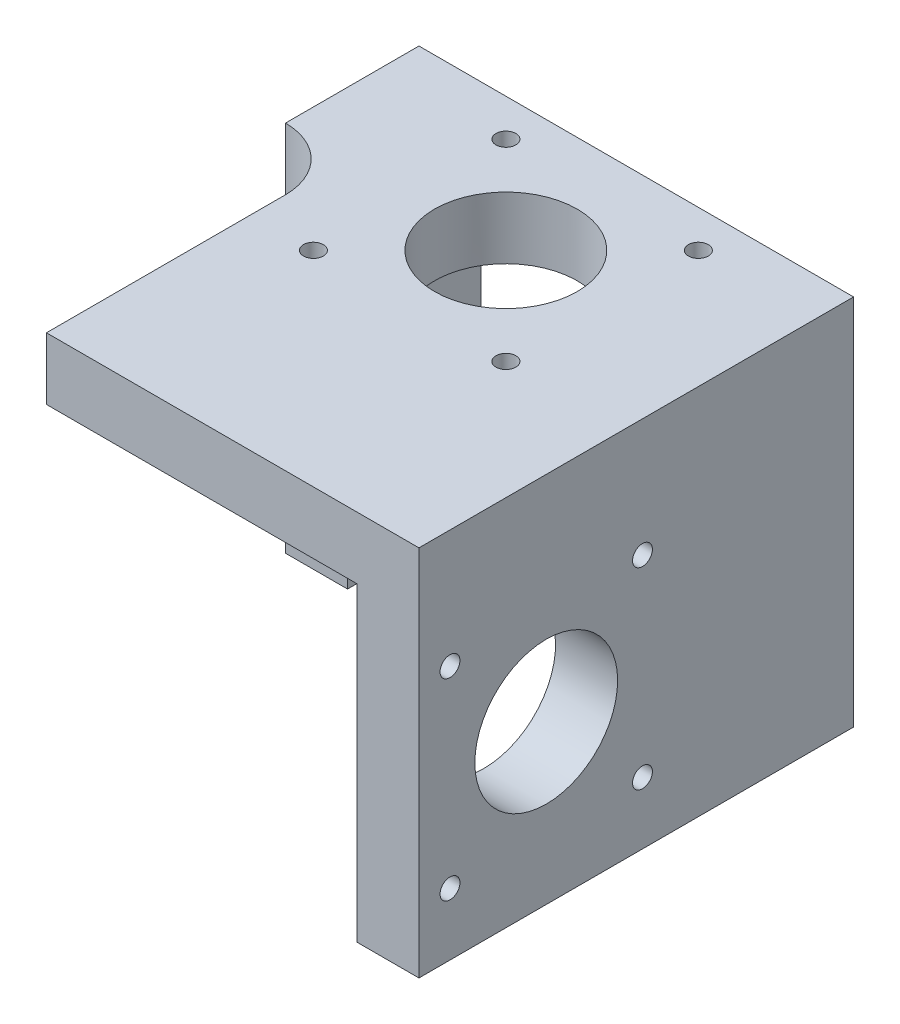
from build123d import *

# Parameters (mm, degrees)
EXTRUDE_1_DEPTH     = 70
SKETCH_2_R          = 1.5999999999999974
SKETCH_2_R_2        = 1.5999999999999979
SKETCH_2_R_3        = 1.6000000000000019
SKETCH_2_R_4        = 1.599999999999995
SKETCH_2_R_5        = 11.5
CUT_EXTRUDE_1_DEPTH = 60
SKETCH_4_R          = 1.6000000000000052
SKETCH_4_R_2        = 1.600000000000005
SKETCH_4_R_3        = 11.499999999999998
CUT_EXTRUDE_2_DEPTH = 60
EXTRUDE_2_DEPTH     = 21.5
SKETCH_7_R          = 4.549999999999999
CUT_EXTRUDE_3_DEPTH = 20.5
FILLET_1_R          = 10
FILLET_START        = 9.961129412
FILLET_2_DEPTH      = 10.1124
FILLET_START_2      = 0.073529412
FILLET_2_2_DEPTH    = 9.8876
FILLET_START_3      = -57.5
FILLET_2_3_DEPTH    = 10


with BuildPart() as part:
    # 草图1 → 凸台-拉伸1 (new body)
    with BuildSketch(Plane.XY):
        Polygon((2.500000000000014, 20.073529411764707), (-47.499999999999986, 20.073529411764703), (-47.499999999999986, 10.073529411764701), (2.500000000000014, 10.073529411764705), (2.5000000000000178, -39.9264705882353), (12.500000000000018, -39.92647058823529), (12.500000000000012, 10.073529411764705), (12.50000000000001, 20.073529411764707), align=None)
    extrude(amount=EXTRUDE_1_DEPTH)

    # 草图2 → 切除-拉伸1 (cut)
    with BuildSketch(Plane.XZ.offset(-10.073529411764705)):
        with Locations((-37.49999999999999, 37)):
            Circle(SKETCH_2_R)
        with Locations((-37.49999999999998, 6)):
            Circle(SKETCH_2_R_2)
        with Locations((-6.4999999999999885, 5.999999999999998)):
            Circle(SKETCH_2_R_3)
        with Locations((-6.499999999999992, 36.99999999999999)):
            Circle(SKETCH_2_R_4)
        with Locations((-21.999999999999996, 21.499999999999996)):
            Circle(SKETCH_2_R_5)
    extrude(amount=-CUT_EXTRUDE_1_DEPTH, mode=Mode.SUBTRACT)

    # 草图4 → 切除-拉伸2 (cut)
    with BuildSketch(Plane.ZY.offset(-2.500000000000012)):
        with Locations(Location((34, 1.0735294117647036, 0), (0, 0, 270))):
            Circle(SKETCH_4_R)
        with Locations(Location((34.000000000000014, -29.926470588235297, 0), (0, 0, 270))):
            Circle(SKETCH_4_R_2)
        with Locations(Location((65, -29.926470588235297, 0), (0, 0, 270))):
            Circle(SKETCH_4_R_2)
        with Locations(Location((65, 1.0735294117647038, 0), (0, 0, 270))):
            Circle(SKETCH_4_R)
        with Locations(Location((49.5, -14.426470588235297, 0), (0, 0, 270))):
            Circle(SKETCH_4_R_3)
    extrude(amount=-CUT_EXTRUDE_2_DEPTH, mode=Mode.SUBTRACT)

    # 草图6 → 凸台-拉伸2 (add)
    with BuildSketch(Plane(origin=(0, 0, 0), x_dir=(-1, 0, 0), z_dir=(0, 0, -1))):
        Polygon((47.499999999999986, 20.073529411764703), (57.499999999999986, 20.073529411764703), (57.49999999999999, -39.9264705882353), (47.49999999999999, -39.9264705882353), align=None)
    extrude(amount=-EXTRUDE_2_DEPTH)

    # 草图7 → 切除-拉伸3 (cut)
    with BuildSketch(Plane.ZY.offset(57.499999999999986)):
        with Locations((21.5, -18.926470588235297)):
            Circle(SKETCH_7_R)
    extrude(amount=-CUT_EXTRUDE_3_DEPTH, mode=Mode.SUBTRACT)

    # 圆角1
    fillet_1_edges = [part.edges().sort_by_distance(p)[0] for p in [
        (-47.499999999999986, 15.073529411764703, 21.5),
    ]]
    fillet(fillet_1_edges, radius=FILLET_1_R - 0.0001)  # a hair under: the kernel refuses the full size

    # 圆角2: read off the stored shape, not the designer's step
    # 圆角2 outline → 圆角2 (add)
    with BuildSketch(Plane(origin=(0, 0, 0), x_dir=(1, 0, 0), z_dir=(0, 1, 0)).offset(FILLET_START)):
        with BuildLine():
            ThreePointArc((-57.5, -21.5), (-50.428932188, -24.428932188), (-47.5, -31.5))
            Line((-47.5, -31.5), (-47.5, -21.5))
            Line((-47.5, -21.5), (-57.5, -21.5))
        make_face()
    extrude(amount=FILLET_2_DEPTH)

    # Fillet 2 2 outline → Fillet 2 2 (add)
    with BuildSketch(Plane(origin=(0, 0, 0), x_dir=(1, 0, 0), z_dir=(0, 1, 0)).offset(FILLET_START_2)):
        with BuildLine():
            ThreePointArc((-57.5, -21.5), (-50.428932188, -24.428932188), (-47.5, -31.5))
            Line((-47.5, -31.5), (-47.5, -21.5))
            Line((-47.5, -21.5), (-57.5, -21.5))
        make_face()
    extrude(amount=FILLET_2_2_DEPTH)

    # Fillet 2 3 outline → Fillet 2 3 (cut)
    with BuildSketch(Plane.YZ.offset(FILLET_START_3)):
        with BuildLine():
            Line((0.073529412, 33), (0.073529412, 21.5))
            ThreePointArc((0.073529412, 21.5), (7.144597224, 24.428932188), (10.073529412, 31.5))
            Line((10.073529412, 31.5), (10.073529412, 33))
            Line((10.073529412, 33), (0.073529412, 33))
        make_face()
    extrude(amount=FILLET_2_3_DEPTH, mode=Mode.SUBTRACT)


solid = part.part
